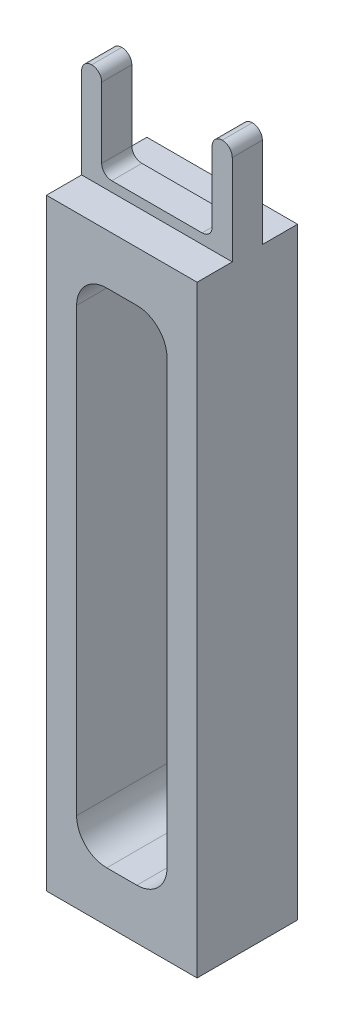
from build123d import *

# Parameters (mm, degrees)
SKETCH1_W           = 15
SKETCH1_H           = 10
BOSS_EXTRUDE1_DEPTH = 60
SKETCH2_W           = 15
SKETCH2_H           = 3
BOSS_EXTRUDE2_DEPTH = 10
SKETCH3_W           = 11
SKETCH3_H           = 18.791084145
CUT_EXTRUDE1_DEPTH  = 71.700070721
FILLET1_R           = 1
CUT_EXTRUDE2_DEPTH  = 72.107313267


with BuildPart() as part:
    # Sketch1 → Boss-Extrude1 (new body)
    with BuildSketch(Plane(origin=(0, 0, 0), x_dir=(1, 0, 0), z_dir=(0, 1, 0))):
        Rectangle(SKETCH1_W, SKETCH1_H)
    extrude(amount=BOSS_EXTRUDE1_DEPTH)

    # Sketch2 → Boss-Extrude2 (add)
    with BuildSketch(Plane(origin=(0, 60, 0), x_dir=(1, 0, 0), z_dir=(0, 1, 0))):
        Rectangle(SKETCH2_W, SKETCH2_H)
    extrude(amount=BOSS_EXTRUDE2_DEPTH)

    # Sketch3 → Cut-Extrude1 (cut, through all)
    with BuildSketch(Plane.XY.offset(1.5)):
        with Locations((0, 70.395542073)):
            Rectangle(SKETCH3_W, SKETCH3_H)
    extrude(amount=-CUT_EXTRUDE1_DEPTH, mode=Mode.SUBTRACT)

    # Fillet1
    fillet1_edges = [part.edges().sort_by_distance(p)[0] for p in [
        (-5.5, 70, 0),
        (5.5, 70, 0),
        (5.5, 61, 0),
        (-5.5, 61, 0),
        (-7.5, 70, 0),
        (7.5, 70, 0),
    ]]
    fillet(fillet1_edges, radius=FILLET1_R - 0.0001)  # a hair under: the kernel refuses the full size

    # Sketch4 → Cut-Extrude2 (cut, through all)
    with BuildSketch(Plane.XY.offset(5)):
        with BuildLine():
            Line((-1.5, 5), (1.5, 5))
            ThreePointArc((1.5, 5), (3.621320344, 5.878679656), (4.5, 8))
            Line((4.5, 8), (4.5, 52))
            ThreePointArc((4.5, 52), (3.621320344, 54.121320344), (1.5, 55))
            Line((1.5, 55), (-1.5, 55))
            ThreePointArc((-1.5, 55), (-3.621320344, 54.121320344), (-4.5, 52))
            Line((-4.5, 52), (-4.5, 8))
            ThreePointArc((-4.5, 8), (-3.621320344, 5.878679656), (-1.5, 5))
        make_face()
    extrude(amount=-CUT_EXTRUDE2_DEPTH, mode=Mode.SUBTRACT)


solid = part.part
